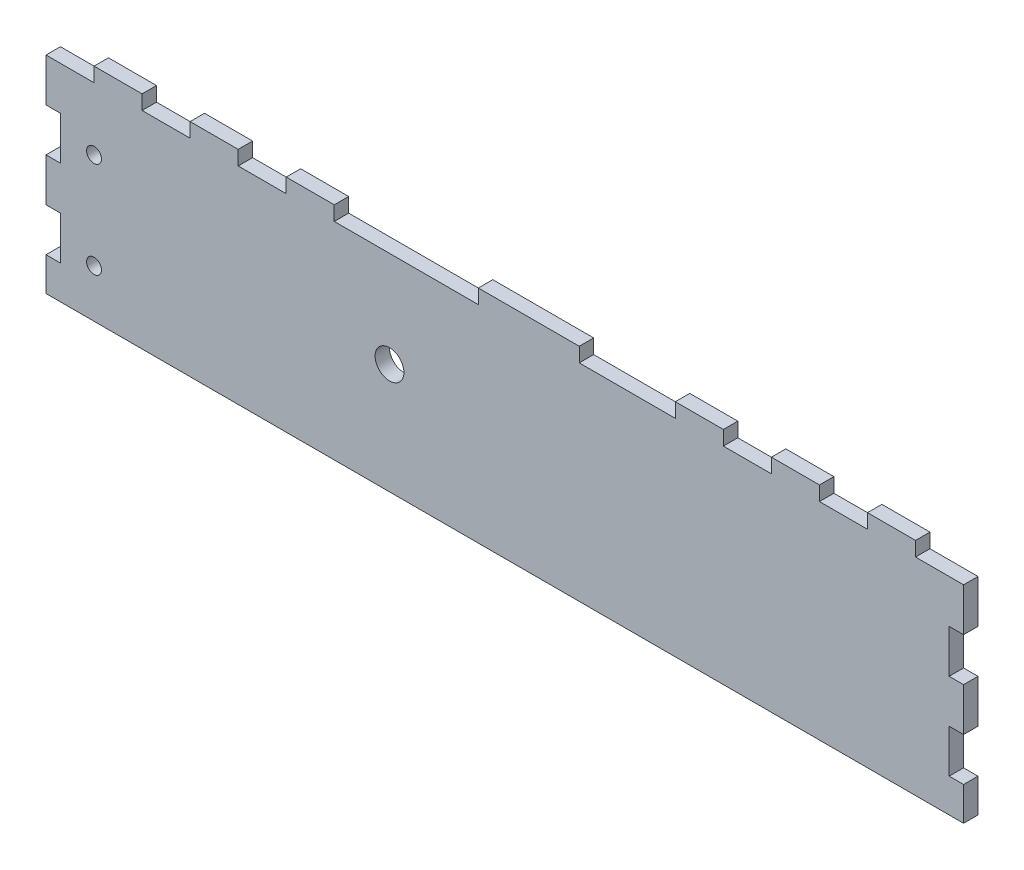
from build123d import *

# Parameters (mm, degrees)
SKETCH1_W           = 191
SKETCH1_H           = 46
SKETCH1_R           = 1.549999948
BOSS_EXTRUDE1_DEPTH = 3
CUT_EXTRUDE1_REACH  = 198.484
SKETCH3_W           = 10
SKETCH3_H           = 3
SKETCH3_W_2         = 30
SKETCH3_W_3         = 20
CUT_EXTRUDE2_REACH  = 198.484
SKETCH4_W           = 3
SKETCH4_H           = 9
CUT_EXTRUDE3_REACH  = 198.484
SKETCH6_R           = 3


with BuildPart() as part:
    # Sketch1 → Boss-Extrude1 (new body)
    with BuildSketch(Plane.XY):
        with Locations((-95.5, 23)):
            Rectangle(SKETCH1_W, SKETCH1_H)
        with Locations((-181, 30)):
            Circle(SKETCH1_R, mode=Mode.SUBTRACT)
        with Locations((-181, 10)):
            Circle(SKETCH1_R, mode=Mode.SUBTRACT)
    extrude(amount=BOSS_EXTRUDE1_DEPTH)

    # Sketch3 → Cut-Extrude1 (cut, up to next)
    with BuildSketch(Plane(origin=(0, 0, 0), x_dir=(-1, 0, 0), z_dir=(0, 0, -1)), mode=Mode.PRIVATE) as cut_extrude1_sk1:
        with Locations((45, 44.5)):
            Rectangle(SKETCH3_W, SKETCH3_H)
    cut_extrude1_tool1 = extrude(cut_extrude1_sk1.sketch, amount=-CUT_EXTRUDE1_REACH, mode=Mode.PRIVATE) & part.part
    # Sketch3 → Cut-Extrude1 (cut, up to next)
    with BuildSketch(Plane(origin=(0, 0, 0), x_dir=(-1, 0, 0), z_dir=(0, 0, -1)), mode=Mode.PRIVATE) as cut_extrude1_sk2:
        with Locations((25, 44.5)):
            Rectangle(SKETCH3_W, SKETCH3_H)
    cut_extrude1_tool2 = extrude(cut_extrude1_sk2.sketch, amount=-CUT_EXTRUDE1_REACH, mode=Mode.PRIVATE) & part.part
    # Sketch3 → Cut-Extrude1 (cut, up to next)
    with BuildSketch(Plane(origin=(0, 0, 0), x_dir=(-1, 0, 0), z_dir=(0, 0, -1)), mode=Mode.PRIVATE) as cut_extrude1_sk3:
        with Locations((5, 44.5)):
            Rectangle(SKETCH3_W, SKETCH3_H)
    cut_extrude1_tool3 = extrude(cut_extrude1_sk3.sketch, amount=-CUT_EXTRUDE1_REACH, mode=Mode.PRIVATE) & part.part
    # Sketch3 → Cut-Extrude1 (cut, up to next)
    with BuildSketch(Plane(origin=(0, 0, 0), x_dir=(-1, 0, 0), z_dir=(0, 0, -1)), mode=Mode.PRIVATE) as cut_extrude1_sk4:
        with Locations((166, 44.5)):
            Rectangle(SKETCH3_W, SKETCH3_H)
    cut_extrude1_tool4 = extrude(cut_extrude1_sk4.sketch, amount=-CUT_EXTRUDE1_REACH, mode=Mode.PRIVATE) & part.part
    # Sketch3 → Cut-Extrude1 (cut, up to next)
    with BuildSketch(Plane(origin=(0, 0, 0), x_dir=(-1, 0, 0), z_dir=(0, 0, -1)), mode=Mode.PRIVATE) as cut_extrude1_sk5:
        with Locations((146, 44.5)):
            Rectangle(SKETCH3_W, SKETCH3_H)
    cut_extrude1_tool5 = extrude(cut_extrude1_sk5.sketch, amount=-CUT_EXTRUDE1_REACH, mode=Mode.PRIVATE) & part.part
    # Sketch3 → Cut-Extrude1 (cut, up to next)
    with BuildSketch(Plane(origin=(0, 0, 0), x_dir=(-1, 0, 0), z_dir=(0, 0, -1)), mode=Mode.PRIVATE) as cut_extrude1_sk6:
        with Locations((116, 44.5)):
            Rectangle(SKETCH3_W_2, SKETCH3_H)
    cut_extrude1_tool6 = extrude(cut_extrude1_sk6.sketch, amount=-CUT_EXTRUDE1_REACH, mode=Mode.PRIVATE) & part.part
    # Sketch3 → Cut-Extrude1 (cut, up to next)
    with BuildSketch(Plane(origin=(0, 0, 0), x_dir=(-1, 0, 0), z_dir=(0, 0, -1)), mode=Mode.PRIVATE) as cut_extrude1_sk7:
        with Locations((70, 44.5)):
            Rectangle(SKETCH3_W_3, SKETCH3_H)
    cut_extrude1_tool7 = extrude(cut_extrude1_sk7.sketch, amount=-CUT_EXTRUDE1_REACH, mode=Mode.PRIVATE) & part.part
    # Sketch3 → Cut-Extrude1 (cut, up to next)
    with BuildSketch(Plane(origin=(0, 0, 0), x_dir=(-1, 0, 0), z_dir=(0, 0, -1)), mode=Mode.PRIVATE) as cut_extrude1_sk8:
        with Locations((186, 44.5)):
            Rectangle(SKETCH3_W, SKETCH3_H)
    cut_extrude1_tool8 = extrude(cut_extrude1_sk8.sketch, amount=-CUT_EXTRUDE1_REACH, mode=Mode.PRIVATE) & part.part
    add(cut_extrude1_tool1.solids().sort_by_distance((-45, 44.5, 0))[0], mode=Mode.SUBTRACT)
    add(cut_extrude1_tool2.solids().sort_by_distance((-25, 44.5, 0))[0], mode=Mode.SUBTRACT)
    add(cut_extrude1_tool3.solids().sort_by_distance((-5, 44.5, 0))[0], mode=Mode.SUBTRACT)
    add(cut_extrude1_tool4.solids().sort_by_distance((-166, 44.5, 0))[0], mode=Mode.SUBTRACT)
    add(cut_extrude1_tool5.solids().sort_by_distance((-146, 44.5, 0))[0], mode=Mode.SUBTRACT)
    add(cut_extrude1_tool6.solids().sort_by_distance((-116, 44.5, 0))[0], mode=Mode.SUBTRACT)
    add(cut_extrude1_tool7.solids().sort_by_distance((-70, 44.5, 0))[0], mode=Mode.SUBTRACT)
    add(cut_extrude1_tool8.solids().sort_by_distance((-186, 44.5, 0))[0], mode=Mode.SUBTRACT)

    # Sketch4 → Cut-Extrude2 (cut, up to next)
    with BuildSketch(Plane.XY.offset(3), mode=Mode.PRIVATE) as cut_extrude2_sk1:
        with Locations((-1.5, 29.5)):
            Rectangle(SKETCH4_W, SKETCH4_H)
    cut_extrude2_tool1 = extrude(cut_extrude2_sk1.sketch, amount=-CUT_EXTRUDE2_REACH, mode=Mode.PRIVATE) & part.part
    # Sketch4 → Cut-Extrude2 (cut, up to next)
    with BuildSketch(Plane.XY.offset(3), mode=Mode.PRIVATE) as cut_extrude2_sk2:
        with Locations((-1.5, 11.5)):
            Rectangle(SKETCH4_W, SKETCH4_H)
    cut_extrude2_tool2 = extrude(cut_extrude2_sk2.sketch, amount=-CUT_EXTRUDE2_REACH, mode=Mode.PRIVATE) & part.part
    cut_extrude2_1 = cut_extrude2_tool1.solids().sort_by_distance((-1.5, 29.5, 3))[0]
    add(cut_extrude2_1, mode=Mode.SUBTRACT)
    cut_extrude2_2 = cut_extrude2_tool2.solids().sort_by_distance((-1.5, 11.5, 3))[0]
    add(cut_extrude2_2, mode=Mode.SUBTRACT)
    cut_extrude2 = cut_extrude2_1 + cut_extrude2_2  # Cut-Extrude2 as one shape, for the pattern or mirror that repeats it

    # Mirror1: Cut-Extrude2 across plane
    add(cut_extrude2.mirror(Plane(origin=(-95.5, 0, 0), x_dir=(0, 0, 1), z_dir=(1, 0, 0))), mode=Mode.SUBTRACT)

    # Sketch6 → Cut-Extrude3 (cut, up to next)
    with BuildSketch(Plane.XY.offset(3), mode=Mode.PRIVATE) as cut_extrude3_sk1:
        with Locations((-119.5, 23)):
            Circle(SKETCH6_R)
    cut_extrude3_tool1 = extrude(cut_extrude3_sk1.sketch, amount=-CUT_EXTRUDE3_REACH, mode=Mode.PRIVATE) & part.part
    add(cut_extrude3_tool1.solids().sort_by_distance((-119.5, 23, 3))[0], mode=Mode.SUBTRACT)


solid = part.part
